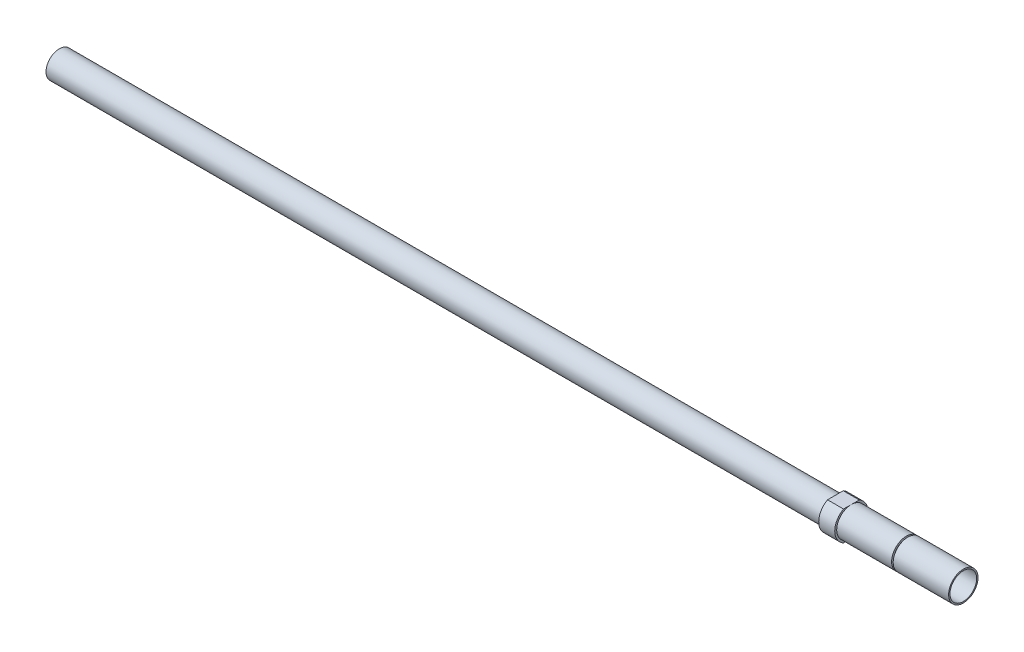
from build123d import *

# Parameters (mm, degrees)
SKETCH2_OUTSIDE_W   = 53.074
SKETCH2_OUTSIDE_H   = 53.074
SKETCH2_OUTSIDE_W_2 = 7.9375
SKETCH2_OUTSIDE_H_2 = 7
CUT_EXTRUDE1_DEPTH  = 216.465114617
CUT_EXTRUDE2_START  = -17.78
SKETCH3_R           = 3.175
CUT_EXTRUDE2_DEPTH  = 168.207698836


with BuildPart() as part:
    # Sketch1 → Revolve1 (revolve)
    with BuildSketch(Plane.XY):
        Polygon((0, 0), (-215.392, 0), (-215.392, 3.175), (-30.48, 3.175), (-30.48, 3.96875), (-26.67, 3.96875), (-26.67, 3.5), (-13.589, 3.5), (-13.589, 3.0226), (-13.208, 3.0226), (-13.208, 3.5), (0, 3.5), align=None)
    revolve(axis=Axis((0, 0, 0), (-1, 0, 0)))

    # Sketch2 outside → Cut-Extrude1 (cut, through all)
    with BuildSketch(Plane(origin=(0, 0, 0), x_dir=(0, 0, -1), z_dir=(1, 0, 0))):
        Rectangle(SKETCH2_OUTSIDE_W, SKETCH2_OUTSIDE_H)
        Rectangle(SKETCH2_OUTSIDE_W_2, SKETCH2_OUTSIDE_H_2, mode=Mode.SUBTRACT)
    extrude(amount=-CUT_EXTRUDE1_DEPTH, mode=Mode.SUBTRACT)

    # Sketch3 → Cut-Extrude2 (cut, through all)
    with BuildSketch(Plane.ZY.offset(30.48).offset(CUT_EXTRUDE2_START)):
        Circle(SKETCH3_R)
    extrude(amount=-CUT_EXTRUDE2_DEPTH, mode=Mode.SUBTRACT)


solid = part.part
